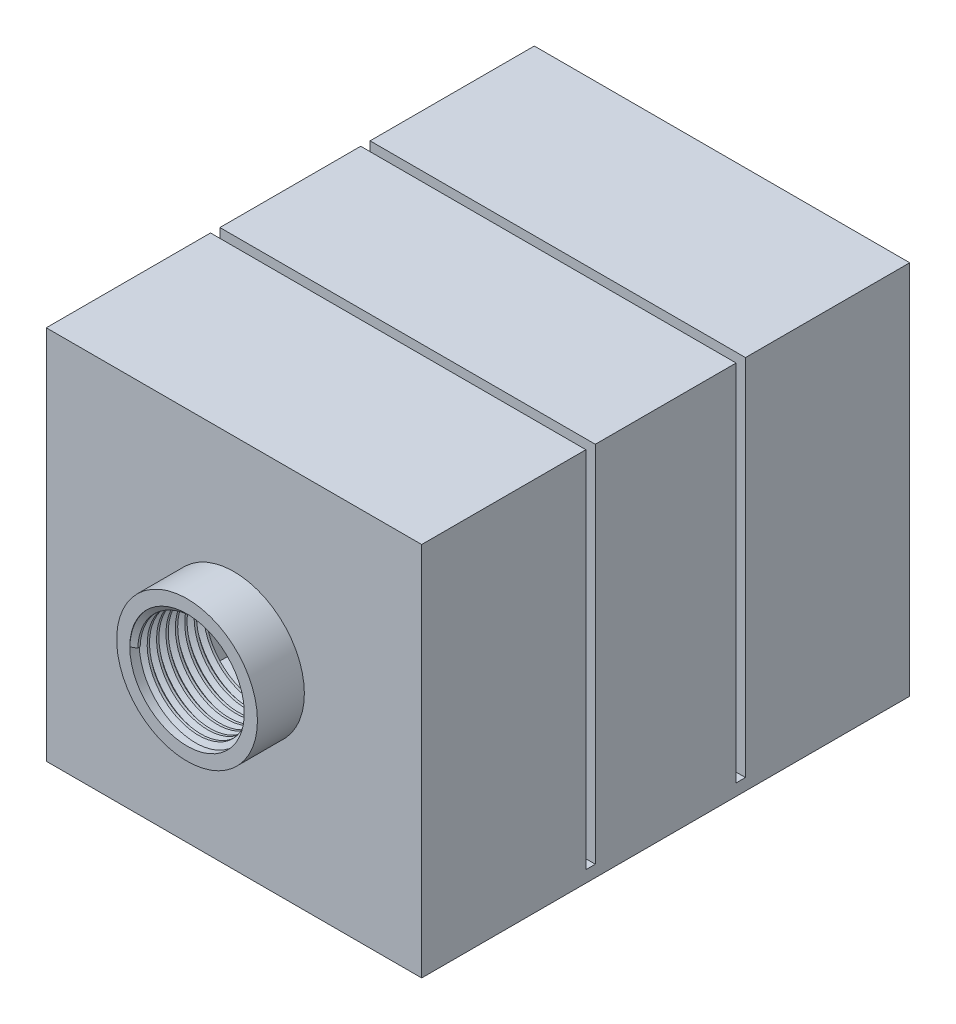
from build123d import *

# Parameters (mm, degrees)
SKETCH1_W           = 80
SKETCH1_H           = 80
SKETCH1_W_2         = 70
SKETCH1_H_2         = 70
BOSS_EXTRUDE1_DEPTH = 30
SKETCH2_W           = 80
SKETCH2_H           = 2.5
BOSS_EXTRUDE2_DEPTH = 2
SKETCH3_W           = 80
SKETCH3_H           = 80
SKETCH3_W_2         = 70
SKETCH3_H_2         = 70
BOSS_EXTRUDE3_DEPTH = 30
SKETCH4_W           = 80
SKETCH4_H           = 2.5
BOSS_EXTRUDE4_DEPTH = 2
SKETCH5_W           = 80
SKETCH5_H           = 80
SKETCH5_W_2         = 70
SKETCH5_H_2         = 70
BOSS_EXTRUDE5_DEPTH = 30
SKETCH6_W           = 80
SKETCH6_H           = 80
SKETCH6_R           = 12.2
BOSS_EXTRUDE6_DEPTH = 15
SKETCH7_W           = 80
SKETCH7_H           = 80
SKETCH7_R           = 16
CUT_EXTRUDE1_DEPTH  = 10
THREAD1_PITCH       = 2
BOSS_EXTRUDE7_START = 15
SKETCH10_W          = 80
SKETCH10_H          = 80
SKETCH10_R          = 12.2
BOSS_EXTRUDE7_DEPTH = 15
SKETCH11_W          = 80
SKETCH11_H          = 80
SKETCH11_R          = 15
CUT_EXTRUDE2_DEPTH  = 10
THREAD2_PITCH       = 2


with BuildPart() as part:
    # Sketch1 → Boss-Extrude1 (new body)
    with BuildSketch(Plane.XY):
        Rectangle(SKETCH1_W, SKETCH1_H)
        Rectangle(SKETCH1_W_2, SKETCH1_H_2, mode=Mode.SUBTRACT)
    extrude(amount=BOSS_EXTRUDE1_DEPTH)

    # Sketch2 → Boss-Extrude2 (add)
    with BuildSketch(Plane(origin=(0, 0, 0), x_dir=(-1, 0, 0), z_dir=(0, 0, -1))):
        with Locations((0, -38.75)):
            Rectangle(SKETCH2_W, SKETCH2_H)
    extrude(amount=BOSS_EXTRUDE2_DEPTH)

    # Sketch3 → Boss-Extrude3 (add)
    with BuildSketch(Plane(origin=(0, 0, -2), x_dir=(-1, 0, 0), z_dir=(0, 0, -1))):
        Rectangle(SKETCH3_W, SKETCH3_H)
        Rectangle(SKETCH3_W_2, SKETCH3_H_2, mode=Mode.SUBTRACT)
    extrude(amount=BOSS_EXTRUDE3_DEPTH)

    # Sketch4 → Boss-Extrude4 (add)
    with BuildSketch(Plane(origin=(0, 0, -32), x_dir=(-1, 0, 0), z_dir=(0, 0, -1))):
        with Locations((0, -38.75)):
            Rectangle(SKETCH4_W, SKETCH4_H)
    extrude(amount=BOSS_EXTRUDE4_DEPTH)

    # Sketch5 → Boss-Extrude5 (add)
    with BuildSketch(Plane(origin=(0, 0, -34), x_dir=(-1, 0, 0), z_dir=(0, 0, -1))):
        Rectangle(SKETCH5_W, SKETCH5_H)
        Rectangle(SKETCH5_W_2, SKETCH5_H_2, mode=Mode.SUBTRACT)
    extrude(amount=BOSS_EXTRUDE5_DEPTH)

    # Sketch6 → Boss-Extrude6 (add)
    with BuildSketch(Plane(origin=(0, 0, -64), x_dir=(-1, 0, 0), z_dir=(0, 0, -1))):
        Rectangle(SKETCH6_W, SKETCH6_H)
        Circle(SKETCH6_R, mode=Mode.SUBTRACT)
    extrude(amount=BOSS_EXTRUDE6_DEPTH)

    # Sketch7 → Cut-Extrude1 (cut)
    with BuildSketch(Plane(origin=(0, 0, -79), x_dir=(-1, 0, 0), z_dir=(0, 0, -1))):
        Rectangle(SKETCH7_W, SKETCH7_H)
        Circle(SKETCH7_R, mode=Mode.SUBTRACT)
    extrude(amount=-CUT_EXTRUDE1_DEPTH, mode=Mode.SUBTRACT)

    # Thread1: the profile of Thread Profile1 profile screwed along a right-hand helix of 7 turns, 10 arcs to a turn; built about Z, then put on its axis
    thread1_z = Axis((0, 0, 0), (0, 0, 1))
    thread1_corners = [(12.2003, 0, -0.000173), (12.2003, 0, 1.750173), (11.117468, 0, 1.125), (11.117468, 0, 0.625)]
    with BuildLine(mode=Mode.PRIVATE) as thread1_profile:
        Line(thread1_corners[0], thread1_corners[1])
        Line(thread1_corners[1], thread1_corners[2])
        Line(thread1_corners[2], thread1_corners[3])
        Line(thread1_corners[3], thread1_corners[0])
    thread1_cap = Face(thread1_profile.wire())
    thread1_turn_angles = [0, 18, 36, 54, 72, 90, 108, 126, 144, 162, 180, 198, 216, 234, 252, 270, 288, 306, 324, 342, 360]
    thread1_turn_weights = [1, 0.9510565162951535, 1, 0.9510565162951535, 1, 0.9510565162951535, 1, 0.9510565162951535, 1, 0.9510565162951535, 1, 0.9510565162951535, 1, 0.9510565162951535, 1, 0.9510565162951535, 1, 0.9510565162951535, 1, 0.9510565162951535, 1]
    thread1_turn_rails = [Edge.make_bspline([Vector(p[0], p[1], 0).rotate(thread1_z, thread1_turn_angles[k]) / thread1_turn_weights[k] + Vector(0, 0, p[2] + THREAD1_PITCH * thread1_turn_angles[k] / 360) for k in range(21)], [0, 0, 0, 1, 1, 2, 2, 3, 3, 4, 4, 5, 5, 6, 6, 7, 7, 8, 8, 9, 9, 10, 10, 10], 2, thread1_turn_weights) for p in thread1_corners]
    thread1_turn_sides = [Face.make_surface_from_curves(thread1_turn_rails[p[0]], thread1_turn_rails[p[1]]) for p in [(0, 1), (1, 2), (2, 3), (3, 0)]]
    thread1 = Plane(origin=(0, 0, -79), x_dir=(1, 0, 0), z_dir=(0, 0, 1)) * Solid(Shell([*[p.moved(Location((0, 0, THREAD1_PITCH * i))) for i in range(7) for p in thread1_turn_sides], thread1_cap, thread1_cap.rotate(thread1_z, 2520).moved(Location((0, 0, THREAD1_PITCH * 2520 / 360)))]))
    add(thread1)

    # Sketch10 → Boss-Extrude7 (add)
    with BuildSketch(Plane.XY.offset(30).offset(BOSS_EXTRUDE7_START)):
        Rectangle(SKETCH10_W, SKETCH10_H)
        Circle(SKETCH10_R, mode=Mode.SUBTRACT)
    extrude(amount=-BOSS_EXTRUDE7_DEPTH)

    # Sketch11 → Cut-Extrude2 (cut)
    with BuildSketch(Plane.XY.offset(45)):
        Rectangle(SKETCH11_W, SKETCH11_H)
        Circle(SKETCH11_R, mode=Mode.SUBTRACT)
    extrude(amount=-CUT_EXTRUDE2_DEPTH, mode=Mode.SUBTRACT)

    # Thread2: the profile of Thread Profile2 profile screwed along a right-hand helix of 7 turns, 10 arcs to a turn; built about Z, then put on its axis
    thread2_z = Axis((0, 0, 0), (0, 0, 1))
    thread2_corners = [(12.2003, 0, -0.000173), (12.2003, 0, 1.750173), (11.117468, 0, 1.125), (11.117468, 0, 0.625)]
    with BuildLine(mode=Mode.PRIVATE) as thread2_profile:
        Line(thread2_corners[0], thread2_corners[1])
        Line(thread2_corners[1], thread2_corners[2])
        Line(thread2_corners[2], thread2_corners[3])
        Line(thread2_corners[3], thread2_corners[0])
    thread2_cap = Face(thread2_profile.wire())
    thread2_turn_angles = [0, 18, 36, 54, 72, 90, 108, 126, 144, 162, 180, 198, 216, 234, 252, 270, 288, 306, 324, 342, 360]
    thread2_turn_weights = [1, 0.9510565162951535, 1, 0.9510565162951535, 1, 0.9510565162951535, 1, 0.9510565162951535, 1, 0.9510565162951535, 1, 0.9510565162951535, 1, 0.9510565162951535, 1, 0.9510565162951535, 1, 0.9510565162951535, 1, 0.9510565162951535, 1]
    thread2_turn_rails = [Edge.make_bspline([Vector(p[0], p[1], 0).rotate(thread2_z, thread2_turn_angles[k]) / thread2_turn_weights[k] + Vector(0, 0, p[2] + THREAD2_PITCH * thread2_turn_angles[k] / 360) for k in range(21)], [0, 0, 0, 1, 1, 2, 2, 3, 3, 4, 4, 5, 5, 6, 6, 7, 7, 8, 8, 9, 9, 10, 10, 10], 2, thread2_turn_weights) for p in thread2_corners]
    thread2_turn_sides = [Face.make_surface_from_curves(thread2_turn_rails[p[0]], thread2_turn_rails[p[1]]) for p in [(0, 1), (1, 2), (2, 3), (3, 0)]]
    thread2 = Plane(origin=(0, 0, 45), x_dir=(-1, 0, 0), z_dir=(0, 0, -1)) * Solid(Shell([*[p.moved(Location((0, 0, THREAD2_PITCH * i))) for i in range(7) for p in thread2_turn_sides], thread2_cap, thread2_cap.rotate(thread2_z, 2520).moved(Location((0, 0, THREAD2_PITCH * 2520 / 360)))]))
    add(thread2)


solid = part.part
